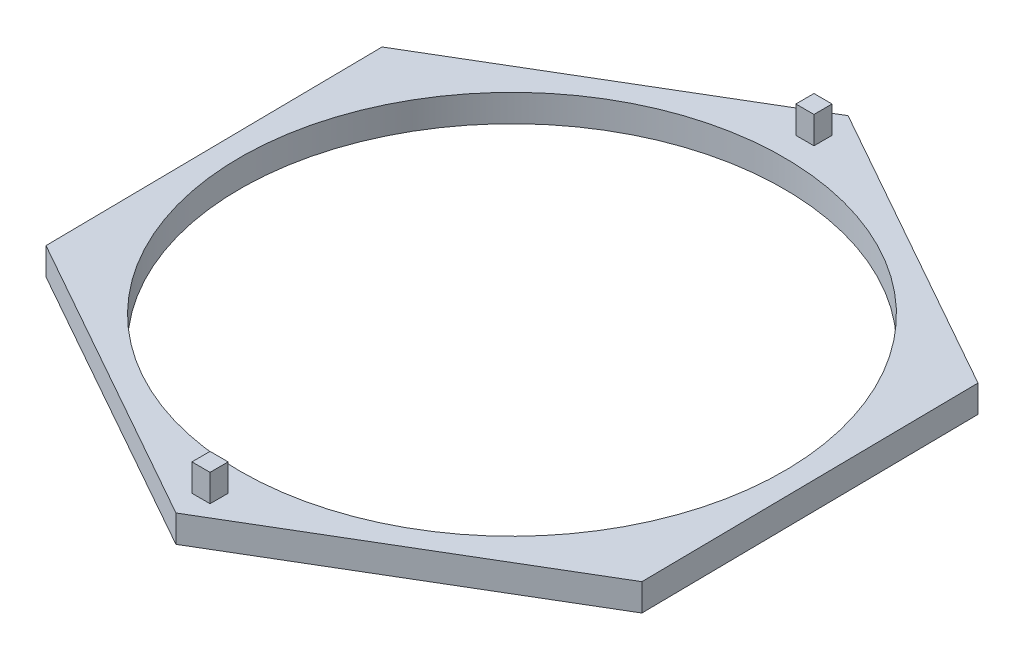
from build123d import *

# Parameters (mm, degrees)
BOSS_EXTRUDE1_DEPTH = 3
SKETCH2_R           = 30
CUT_EXTRUDE1_DEPTH  = 50.876169719
SKETCH3_W           = 2
SKETCH3_H           = 2
BOSS_EXTRUDE2_DEPTH = 3
SKETCH4_W           = 2
SKETCH4_H           = 2
BOSS_EXTRUDE3_DEPTH = 3


with BuildPart() as part:
    # Sketch1 → Boss-Extrude1 (new body)
    with BuildSketch(Plane(origin=(0, 0, 0), x_dir=(1, 0, 0), z_dir=(0, 1, 0))):
        Polygon((-32.718400228, 18.380414028), (-32.277105594, -19.144758755), (0.441294634, -37.525172783), (32.718400228, -18.380414028), (32.277105594, 19.144758755), (-0.441294634, 37.525172783), align=None)
    extrude(amount=BOSS_EXTRUDE1_DEPTH)

    # Sketch2 → Cut-Extrude1 (cut, through all)
    with BuildSketch(Plane(origin=(0, 3, 0), x_dir=(1, 0, 0), z_dir=(0, 1, 0))):
        Circle(SKETCH2_R)
    extrude(amount=-CUT_EXTRUDE1_DEPTH, mode=Mode.SUBTRACT)

    # Sketch3 → Boss-Extrude2 (add)
    with BuildSketch(Plane(origin=(0, 3, 0), x_dir=(1, 0, 0), z_dir=(0, 1, 0))):
        with Locations((-0.441294634, 33.760963462)):
            Rectangle(SKETCH3_W, SKETCH3_H)
    extrude(amount=BOSS_EXTRUDE2_DEPTH)

    # Sketch4 → Boss-Extrude3 (add)
    with BuildSketch(Plane(origin=(0, 3, 0), x_dir=(1, 0, 0), z_dir=(0, 1, 0))):
        with Locations((0.441294634, -33.760963462)):
            Rectangle(SKETCH4_W, SKETCH4_H)
    extrude(amount=BOSS_EXTRUDE3_DEPTH)


solid = part.part
